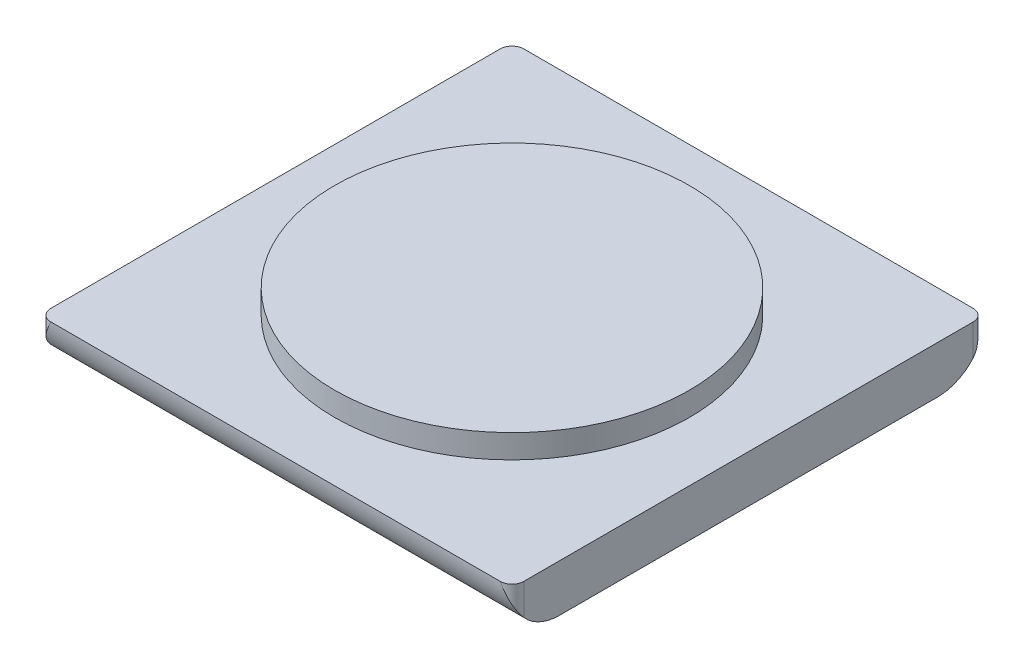
from build123d import *

# Parameters (mm, degrees)
TURNTABLE_SKETCH_R          = 75
TURNTABLE_EXTRUDE_DEPTH     = 10
SUPPORT_PLATE_SKETCH_W      = 200
SUPPORT_PLATE_SKETCH_H      = 200
SUPPORT_PLATE_EXTRUDE_DEPTH = 20
SUPPORT_PLATE_FILLET_R      = 5
BOTTOM_FILLET_R             = 20


with BuildPart() as part:
    # Turntable Sketch → Turntable Extrude (new body)
    with BuildSketch(Plane(origin=(0, 0, 0), x_dir=(1, 0, 0), z_dir=(0, 1, 0))):
        with Locations(Location((0, 0, 0), (0, 0, 270))):
            Circle(TURNTABLE_SKETCH_R)
    extrude(amount=TURNTABLE_EXTRUDE_DEPTH)


with BuildPart() as body_2:
    # Support Plate Sketch → Support Plate Extrude (new body)
    with BuildSketch(Plane(origin=(0, 0, 0), x_dir=(1, 0, 0), z_dir=(0, 1, 0))):
        Rectangle(SUPPORT_PLATE_SKETCH_W, SUPPORT_PLATE_SKETCH_H)
    extrude(amount=-SUPPORT_PLATE_EXTRUDE_DEPTH)

    # Support Plate Fillet
    support_plate_fillet_edges = [body_2.edges().sort_by_distance(p)[0] for p in [
        (100, -10, 100),
        (-100, -10, 100),
        (-100, -10, -100),
        (100, -10, -100),
    ]]
    fillet(support_plate_fillet_edges, radius=SUPPORT_PLATE_FILLET_R)

    # Bottom Fillet
    # the kernel refuses this fillet: 20 mm, written as the material it takes off along each edge
    with BuildSketch(Plane(origin=(-145, -20, -100), x_dir=(0, 1, 0), z_dir=(1, 0, 0))) as bottom_fillet_piece_1:
        with BuildLine():
            CenterArc((BOTTOM_FILLET_R, BOTTOM_FILLET_R), BOTTOM_FILLET_R, 180, 90)
            Line((0, BOTTOM_FILLET_R), (0, 0))
            Line((0, 0), (BOTTOM_FILLET_R, 0))
        make_face()
    extrude(amount=290, mode=Mode.SUBTRACT)
    with BuildSketch(Plane(origin=(145, -20, 100), x_dir=(0, 0, -1), z_dir=(-1, 0, 0))) as bottom_fillet_piece_2:
        with BuildLine():
            CenterArc((BOTTOM_FILLET_R, -BOTTOM_FILLET_R), BOTTOM_FILLET_R, 90, 90)
            Line((0, -BOTTOM_FILLET_R), (0, 0))
            Line((0, 0), (BOTTOM_FILLET_R, 0))
        make_face()
    extrude(amount=290, mode=Mode.SUBTRACT)


solid = Compound([part.part, body_2.part])
